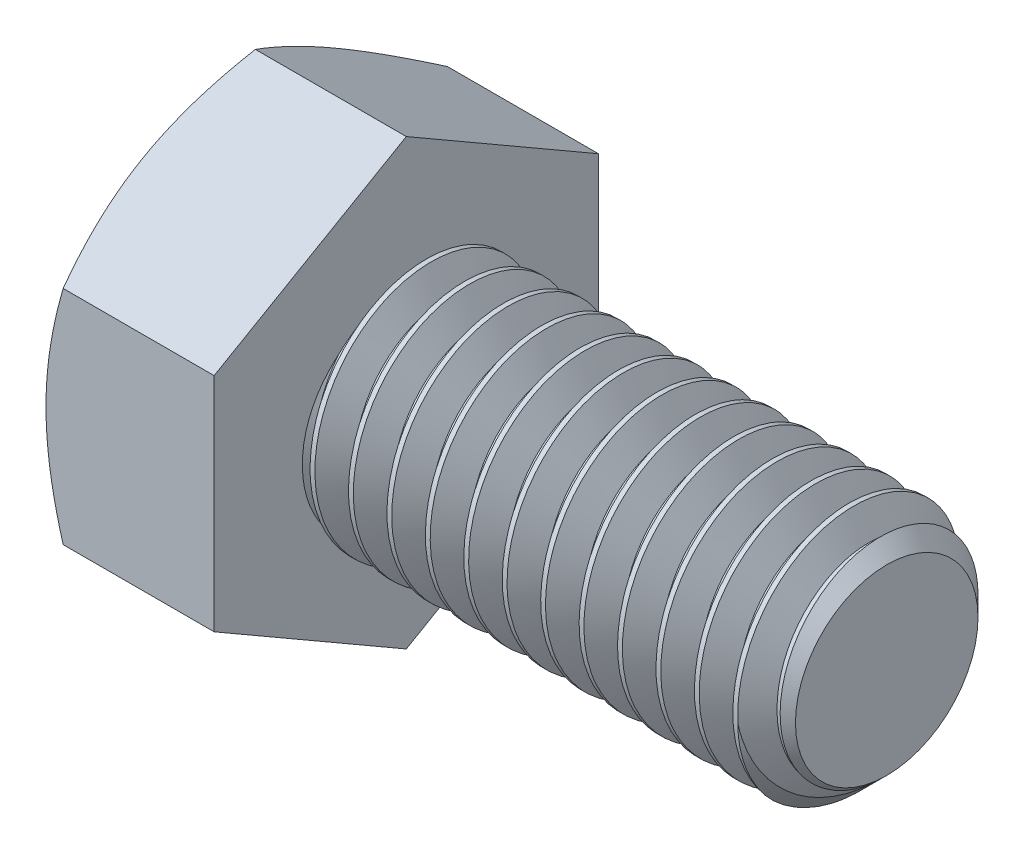
from build123d import *

# Parameters (mm, degrees)
SKETCH2_R           = 2.5
BOSS_EXTRUDE1_DEPTH = 10
CHAMFER1_SIZE       = 0.6
CUT_SWEEP1_PITCH    = 0.8
BOSS_EXTRUDE2_DEPTH = 3.5
SKETCH6_OUTSIDE_W   = 68.438
SKETCH6_OUTSIDE_H   = 69.676
SKETCH6_OUTSIDE_R   = 4
CUT_EXTRUDE1_DEPTH  = 15.818344636
CUT_EXTRUDE1_DRAFT  = -60


with BuildPart() as part:
    # Sketch2 → Boss-Extrude1 (new body)
    with BuildSketch(Plane(origin=(6.75, 0, 0), x_dir=(0, 0, -1), z_dir=(1, 0, 0))):
        Circle(SKETCH2_R)
    extrude(amount=-BOSS_EXTRUDE1_DEPTH)

    # Chamfer1
    chamfer1_edges = [part.edges().sort_by_distance(p)[0] for p in [
        (6.75, 0, 2.5),
    ]]
    chamfer(chamfer1_edges, length=CHAMFER1_SIZE)

    # Cut-Sweep1: the profile of Sketch5 profile screwed along a right-hand helix of 13.5 turns, 8 arcs to a turn; built about Z, then put on its axis
    cut_sweep1_z = Axis((0, 0, 0), (0, 0, 1))
    cut_sweep1_corners = [(2.5003, 0, 0.000173205), (1.980384758, 0, -0.3), (1.980384758, 0, -0.4), (2.5003, 0, -0.700173205)]
    with BuildLine(mode=Mode.PRIVATE) as cut_sweep1_profile:
        Line(cut_sweep1_corners[0], cut_sweep1_corners[1])
        Line(cut_sweep1_corners[1], cut_sweep1_corners[2])
        Line(cut_sweep1_corners[2], cut_sweep1_corners[3])
        Line(cut_sweep1_corners[3], cut_sweep1_corners[0])
    cut_sweep1_cap = Face(cut_sweep1_profile.wire())
    cut_sweep1_turn_angles = [0, 22.5, 45, 67.5, 90, 112.5, 135, 157.5, 180, 202.5, 225, 247.5, 270, 292.5, 315, 337.5, 360]
    cut_sweep1_turn_weights = [1, 0.9238795325112867, 1, 0.9238795325112867, 1, 0.9238795325112867, 1, 0.9238795325112867, 1, 0.9238795325112867, 1, 0.9238795325112867, 1, 0.9238795325112867, 1, 0.9238795325112867, 1]
    cut_sweep1_turn_rails = [Edge.make_bspline([Vector(p[0], p[1], 0).rotate(cut_sweep1_z, cut_sweep1_turn_angles[k]) / cut_sweep1_turn_weights[k] + Vector(0, 0, p[2] + CUT_SWEEP1_PITCH * cut_sweep1_turn_angles[k] / 360) for k in range(17)], [0, 0, 0, 1, 1, 2, 2, 3, 3, 4, 4, 5, 5, 6, 6, 7, 7, 8, 8, 8], 2, cut_sweep1_turn_weights) for p in cut_sweep1_corners]
    cut_sweep1_turn_sides = [Face.make_surface_from_curves(cut_sweep1_turn_rails[p[0]], cut_sweep1_turn_rails[p[1]]) for p in [(0, 1), (1, 2), (2, 3), (3, 0)]]
    cut_sweep1_last_angles = [4680, 4702.5, 4725, 4747.5, 4770, 4792.5, 4815, 4837.5, 4860]
    cut_sweep1_last_weights = [1, 0.9238795325112867, 1, 0.9238795325112867, 1, 0.9238795325112867, 1, 0.9238795325112381, 1]
    cut_sweep1_last_rails = [Edge.make_bspline([Vector(p[0], p[1], 0).rotate(cut_sweep1_z, cut_sweep1_last_angles[k]) / cut_sweep1_last_weights[k] + Vector(0, 0, p[2] + CUT_SWEEP1_PITCH * cut_sweep1_last_angles[k] / 360) for k in range(9)], [0, 0, 0, 1, 1, 2, 2, 3, 3, 4, 4, 4], 2, cut_sweep1_last_weights) for p in cut_sweep1_corners]
    cut_sweep1_last_sides = [Face.make_surface_from_curves(cut_sweep1_last_rails[p[0]], cut_sweep1_last_rails[p[1]]) for p in [(0, 1), (1, 2), (2, 3), (3, 0)]]
    cut_sweep1 = Plane(origin=(6.75, 0, 0), x_dir=(0, 1, 0), z_dir=(-1, 0, 0)) * Solid(Shell([*[p.moved(Location((0, 0, CUT_SWEEP1_PITCH * i))) for i in range(13) for p in cut_sweep1_turn_sides], *cut_sweep1_last_sides, cut_sweep1_cap, cut_sweep1_cap.rotate(cut_sweep1_z, 4860).moved(Location((0, 0, CUT_SWEEP1_PITCH * 4860 / 360)))]))
    add(cut_sweep1, mode=Mode.SUBTRACT)

    # Sketch3 → Boss-Extrude2 (add)
    with BuildSketch(Plane.ZY.offset(3.25)):
        Polygon((-4, -2.309401077), (0, -4.618802154), (4, -2.309401077), (4, 2.309401077), (0, 4.618802154), (-4, 2.309401077), align=None)
    extrude(amount=BOSS_EXTRUDE2_DEPTH)


with BuildPart() as cut_extrude1_tool:
    # Sketch6 outside → Cut-Extrude1 (with draft: the straight prism first)
    with BuildSketch(Plane.ZY.offset(6.75)):
        Rectangle(SKETCH6_OUTSIDE_W, SKETCH6_OUTSIDE_H)
        Circle(SKETCH6_OUTSIDE_R, mode=Mode.SUBTRACT)
    extrude(amount=-CUT_EXTRUDE1_DEPTH)
    # Cut-Extrude1: the draft: its side faces are tilted about the plane it starts from
    cut_extrude1_sides = [cut_extrude1_tool.faces().sort_by_distance(p)[0] for p in [
        (1.159172318, -34.838, 0),
        (1.159172318, 0, 34.219),
        (1.159172318, 34.838, 0),
        (1.159172318, 0, -34.219),
        (1.159172318, 0, -4),
    ]]
    draft(cut_extrude1_sides, Plane.ZY.offset(6.75), CUT_EXTRUDE1_DRAFT)


with BuildPart() as part_1:
    add(part.part)

    # Cut-Extrude1: cut by cut_extrude1_tool
    add(cut_extrude1_tool.part, mode=Mode.SUBTRACT)


solid = part_1.part
